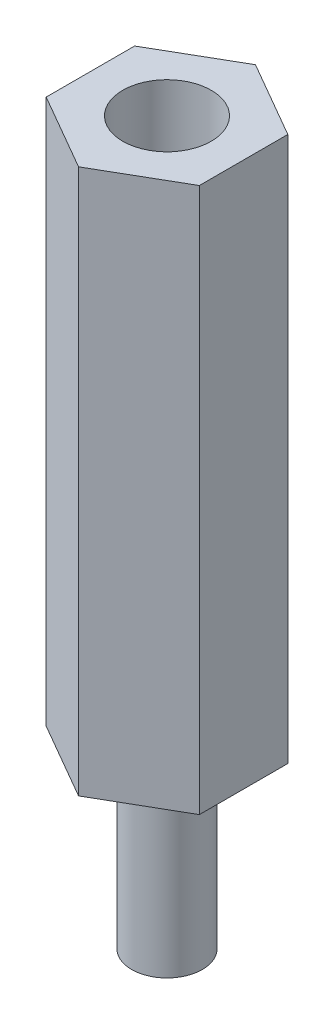
from build123d import *

# Parameters (mm, degrees)
SKETCH1_R   = 1.25
BODY_DEPTH  = 14.4
END_DEPTH   = 1
SKETCH3_R   = 1
SCREW_DEPTH = 5


with BuildPart() as part:
    # Sketch1 → Body (new body)
    with BuildSketch(Plane(origin=(0, 0, 0), x_dir=(1, 0, 0), z_dir=(0, 1, 0))):
        Polygon((0, 2.5), (-2.165063509, 1.25), (-2.165063509, -1.25), (0, -2.5), (2.165063509, -1.25), (2.165063509, 1.25), align=None)
        Circle(SKETCH1_R, mode=Mode.SUBTRACT)
    extrude(amount=BODY_DEPTH)

    # Sketch2 → End (add)
    with BuildSketch(Plane.XZ):
        Polygon((0, -2.5), (2.165063509, -1.25), (2.165063509, 1.25), (0, 2.5), (-2.165063509, 1.25), (-2.165063509, -1.25), align=None)
    extrude(amount=END_DEPTH)

    # Sketch3 → Screw (add)
    with BuildSketch(Plane.XZ.offset(1)):
        Circle(SKETCH3_R)
    extrude(amount=SCREW_DEPTH)


solid = part.part
